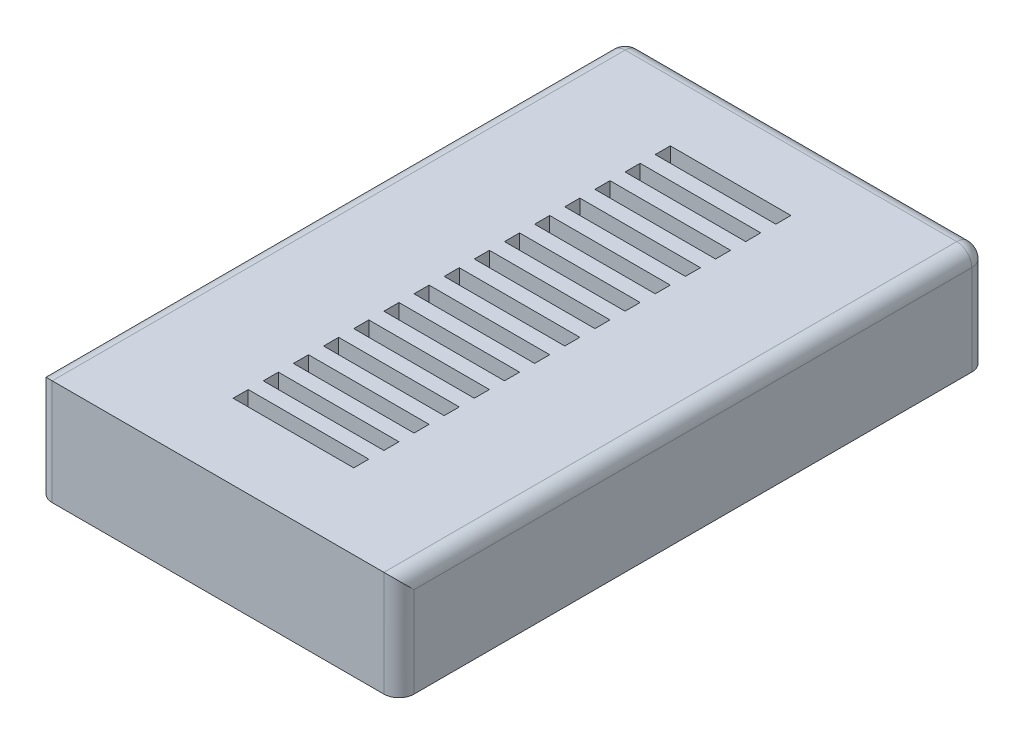
from build123d import *

# Parameters (mm, degrees)
SKIZZE1_W                       = 20
SKIZZE1_H                       = 5
AUFSATZ_LINEAR_AUSTRAGEN1_DEPTH = 35
WANDUNG1_T                      = 2
VERRUNDUNG1_R                   = 1
VERRUNDUNG3_R                   = 1
SKIZZE6_W                       = 20
SKIZZE6_H                       = 35
SKIZZE6_W_2                     = 16
SKIZZE6_H_2                     = 31
AUFSATZ_LINEAR_AUSTRAGEN2_DEPTH = 1
SKIZZE7_W                       = 8
SKIZZE7_H                       = 1
SCHNITT_LINEAR_AUSTRAGEN1_DEPTH = 2
LINEARES_MUSTER1_COUNT          = 8
LINEARES_MUSTER1_PITCH          = 2
LINEARES_MUSTER1_COL_COUNT      = 8
LINEARES_MUSTER1_COL_PITCH      = 2


with BuildPart() as part:
    # Skizze1 → Aufsatz-Linear austragen1 (new body)
    with BuildSketch(Plane.XY):
        with Locations((10, 2.5)):
            Rectangle(SKIZZE1_W, SKIZZE1_H)
    extrude(amount=AUFSATZ_LINEAR_AUSTRAGEN1_DEPTH)

    # Wandung1
    wandung1_openings = [part.faces().sort_by_distance(p)[0] for p in [
        (10, 0, 17.5),
    ]]
    offset(amount=WANDUNG1_T, openings=wandung1_openings, kind=Kind.INTERSECTION)

    # Verrundung1
    # the kernel refuses this fillet: 1 mm, written as the material it takes off along each edge
    with BuildSketch(Plane(origin=(21, 6, -1), x_dir=(1, 0, 0), z_dir=(0, 0, -1))) as verrundung1_piece_1_section:
        Polygon((0, 0), (VERRUNDUNG1_R, 0), (VERRUNDUNG1_R, -VERRUNDUNG1_R), (0, -VERRUNDUNG1_R), align=None)
    verrundung1_piece_1 = extrude(amount=VERRUNDUNG1_R, mode=Mode.PRIVATE)
    verrundung1_piece_1 = verrundung1_piece_1 - Plane(origin=(21, 6, -1), x_dir=(-0.7071067811865475, -0.7071067811865475, 0), z_dir=(0, 0, -1)) * Sphere(VERRUNDUNG1_R, mode=Mode.PRIVATE)
    add(verrundung1_piece_1, mode=Mode.SUBTRACT)
    with BuildSketch(Plane(origin=(-1, 6, -1), x_dir=(0, 0, -1), z_dir=(-1, 0, 0))) as verrundung1_piece_2_section:
        Polygon((0, 0), (VERRUNDUNG1_R, 0), (VERRUNDUNG1_R, -VERRUNDUNG1_R), (0, -VERRUNDUNG1_R), align=None)
    verrundung1_piece_2 = extrude(amount=VERRUNDUNG1_R, mode=Mode.PRIVATE)
    verrundung1_piece_2 = verrundung1_piece_2 - Plane(origin=(-1, 6, -1), x_dir=(0, -0.7071067811865475, 0.7071067811865475), z_dir=(-1, 0, 0)) * Sphere(VERRUNDUNG1_R, mode=Mode.PRIVATE)
    add(verrundung1_piece_2, mode=Mode.SUBTRACT)
    with BuildSketch(Plane(origin=(22, -2.5, 37), x_dir=(0, 0, -1), z_dir=(0, 1, 0)), Plane(origin=(-2, 9.5, 37), x_dir=(0, 0, -1), z_dir=(0, -1, 0))) as verrundung1_piece_3:
        with BuildLine():
            CenterArc((VERRUNDUNG1_R, VERRUNDUNG1_R), VERRUNDUNG1_R, 180, 90)
            Line((0, VERRUNDUNG1_R), (0, 0))
            Line((0, 0), (VERRUNDUNG1_R, 0))
        make_face()
    extrude(amount=12, mode=Mode.SUBTRACT)
    with BuildSketch(Plane(origin=(21, 7, -2), x_dir=(0, 0, 1), z_dir=(-1, 0, 0))) as verrundung1_piece_4:
        with BuildLine():
            CenterArc((VERRUNDUNG1_R, -VERRUNDUNG1_R), VERRUNDUNG1_R, 90, 90)
            Line((0, -VERRUNDUNG1_R), (0, 0))
            Line((0, 0), (VERRUNDUNG1_R, 0))
        make_face()
    extrude(amount=22, mode=Mode.SUBTRACT)
    with BuildSketch(Plane(origin=(22, -2.5, -2), x_dir=(0, 0, 1), z_dir=(0, 1, 0)), Plane(origin=(-2, 6, -2), x_dir=(0, 0, 1), z_dir=(0, -1, 0))) as verrundung1_piece_5:
        with BuildLine():
            CenterArc((VERRUNDUNG1_R, -VERRUNDUNG1_R), VERRUNDUNG1_R, 90, 90)
            Line((0, -VERRUNDUNG1_R), (0, 0))
            Line((0, 0), (VERRUNDUNG1_R, 0))
        make_face()
    extrude(amount=8.5, mode=Mode.SUBTRACT)
    with BuildSketch(Plane(origin=(-2, 7, -1), x_dir=(1, 0, 0), z_dir=(0, 0, 1)), Plane(origin=(22, 7, -1), x_dir=(0, -1, 0), z_dir=(0, 0, 1))) as verrundung1_piece_6:
        with BuildLine():
            CenterArc((VERRUNDUNG1_R, -VERRUNDUNG1_R), VERRUNDUNG1_R, 90, 90)
            Line((0, -VERRUNDUNG1_R), (0, 0))
            Line((0, 0), (VERRUNDUNG1_R, 0))
        make_face()
    extrude(amount=40.5, mode=Mode.SUBTRACT)

    # Verrundung3
    verrundung3_edges = [part.edges().sort_by_distance(p)[0] for p in [
        (10, 0, 0),
        (0, 0, 17.5),
        (20, 0, 17.5),
        (10, 0, 35),
    ]]
    fillet(verrundung3_edges, radius=VERRUNDUNG3_R)

    # Skizze6 → Aufsatz-Linear austragen2 (add)
    with BuildSketch(Plane.XZ.offset(-5)):
        with Locations((10, 17.5)):
            Rectangle(SKIZZE6_W, SKIZZE6_H)
        with Locations((10, 17.5)):
            Rectangle(SKIZZE6_W_2, SKIZZE6_H_2, mode=Mode.SUBTRACT)
    extrude(amount=AUFSATZ_LINEAR_AUSTRAGEN2_DEPTH)

    # Skizze7 → Schnitt-Linear austragen1 (cut)
    with BuildSketch(Plane.XZ.offset(-5)):
        with Locations((10, 17.5)):
            Rectangle(SKIZZE7_W, SKIZZE7_H)
    schnitt_linear_austragen1 = extrude(amount=-SCHNITT_LINEAR_AUSTRAGEN1_DEPTH, mode=Mode.SUBTRACT)

    # Lineares Muster1: Schnitt-Linear austragen1 ×8
    with Locations(*[(0, 0, -i * LINEARES_MUSTER1_PITCH) for i in range(1, LINEARES_MUSTER1_COUNT)]):
        add(schnitt_linear_austragen1, mode=Mode.SUBTRACT)

    # Lineares Muster1 col: Schnitt-Linear austragen1 ×8
    with Locations(*[(0, 0, i * LINEARES_MUSTER1_COL_PITCH) for i in range(1, LINEARES_MUSTER1_COL_COUNT)]):
        add(schnitt_linear_austragen1, mode=Mode.SUBTRACT)


solid = part.part
